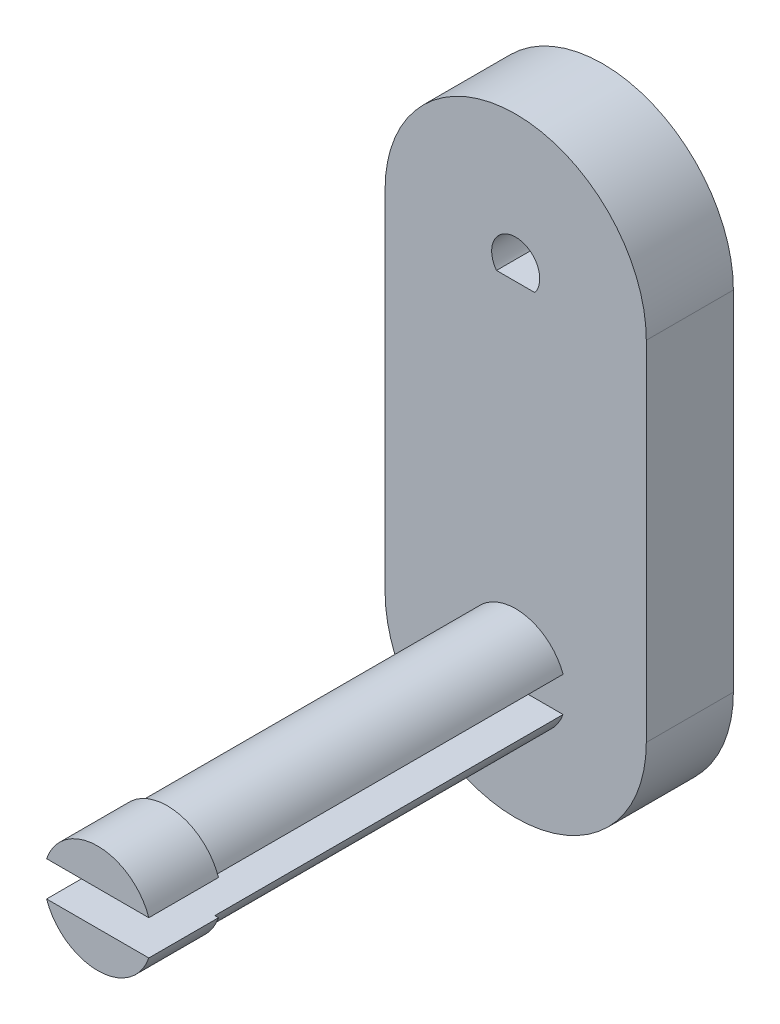
from build123d import *

# Parameters (mm, degrees)
BOSS_EXTRU_1_START      = 10
BOSS_EXTRU_1_DEPTH      = 5
ESQUISSE2_R             = 2.9
BOSS_EXTRU_2_DEPTH      = 20
ESQUISSE3_R             = 3.1
BOSS_EXTRU_3_DEPTH      = 4
ESQUISSE4_W             = 10
ESQUISSE4_H             = 2
ENL_V_MAT_EXTRU_1_DEPTH = 24
ENL_V_MAT_EXTRU_2_DEPTH = 24


with BuildPart() as part:
    # Esquisse1 → Boss.-Extru.1 (new body)
    with BuildSketch(Plane(origin=(0, 0, 0), x_dir=(-1, 0, 0), z_dir=(0, 0, -1)).offset(BOSS_EXTRU_1_START)):
        with BuildLine():
            Line((7.5, 0), (7.5, -20))
            ThreePointArc((7.5, -20), (0, -27.5), (-7.5, -20))
            Line((-7.5, -20), (-7.5, 0))
            ThreePointArc((-7.5, 0), (0, 7.5), (7.5, 0))
        make_face()
    extrude(amount=BOSS_EXTRU_1_DEPTH)

    # Esquisse2 → Boss.-Extru.2 (add)
    with BuildSketch(Plane.XY.offset(-10)):
        with Locations((0, -20)):
            Circle(ESQUISSE2_R)
    extrude(amount=BOSS_EXTRU_2_DEPTH)

    # Esquisse3 → Boss.-Extru.3 (add)
    with BuildSketch(Plane.XY.offset(10)):
        with Locations((0, -20)):
            Circle(ESQUISSE3_R)
    extrude(amount=BOSS_EXTRU_3_DEPTH)

    # Esquisse4 → Enlèv. mat.-Extru.1 (cut)
    with BuildSketch(Plane.XY.offset(14)):
        with Locations((0, -20)):
            Rectangle(ESQUISSE4_W, ESQUISSE4_H)
    extrude(amount=-ENL_V_MAT_EXTRU_1_DEPTH, mode=Mode.SUBTRACT)

    # Esquisse5 → Enlèv. mat.-Extru.2 (cut)
    with BuildSketch(Plane.XY.offset(-10)):
        with BuildLine():
            Line((-1.102497166, -0.83), (1.102497166, -0.83))
            ThreePointArc((1.102497166, -0.83), (0, 1.38), (-1.102497166, -0.83))
        make_face()
    extrude(amount=-ENL_V_MAT_EXTRU_2_DEPTH, mode=Mode.SUBTRACT)


solid = part.part
